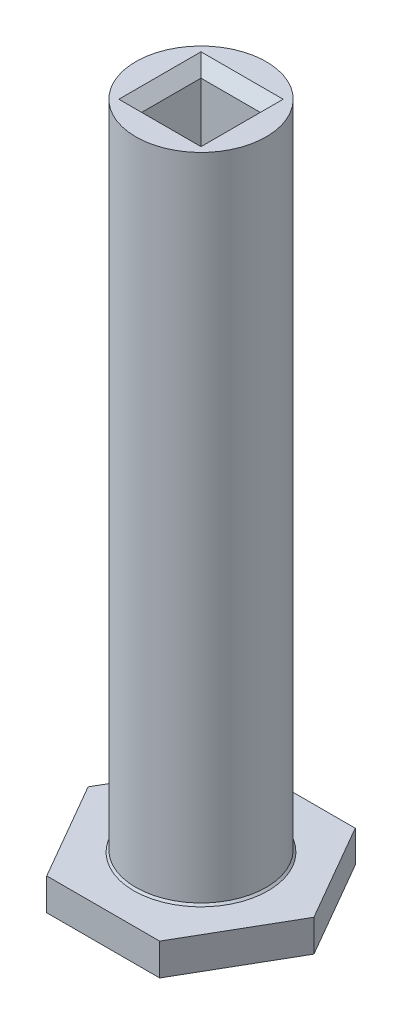
from build123d import *

# Parameters (mm, degrees)
KEY_DEPTH                     = 6.223
SKETCH2_R                     = 12.7
SHAFT_AND_WEIGHT_HOLDER_DEPTH = 127
SKETCH3_W                     = 11.557
SKETCH3_H                     = 11.557
F_8MM_SCREW_HOLE_DEPTH        = 15.875
CHAMFER1_SIZE                 = 0.381
CHAMFER2_SIZE                 = 2.2225


with BuildPart() as part:
    # Sketch1 → Key (new body)
    with BuildSketch(Plane(origin=(0, 0, 0), x_dir=(1, 0, 0), z_dir=(0, 1, 0))):
        Polygon((10.998522628, -19.05), (21.997045256, 0), (10.998522628, 19.05), (-10.998522628, 19.05), (-21.997045256, 0), (-10.998522628, -19.05), align=None)
    extrude(amount=KEY_DEPTH)


with BuildPart() as body_2:
    # Sketch2 → Shaft and Weight Holder (new body)
    with BuildSketch(Plane(origin=(0, 6.223, 0), x_dir=(1, 0, 0), z_dir=(0, 1, 0))):
        Circle(SKETCH2_R)
    extrude(amount=SHAFT_AND_WEIGHT_HOLDER_DEPTH)

    # Sketch3 → 8mm Screw Hole (cut)
    with BuildSketch(Plane(origin=(0, 133.223, 0), x_dir=(1, 0, 0), z_dir=(0, 1, 0))):
        Rectangle(SKETCH3_W, SKETCH3_H)
    extrude(amount=-F_8MM_SCREW_HOLE_DEPTH, mode=Mode.SUBTRACT)

    # Combine1: union part
    add(part.part)

    # Chamfer1
    chamfer1_edges = [body_2.edges().sort_by_distance(p)[0] for p in [
        (-12.7, 6.223, 0),
    ]]
    chamfer(chamfer1_edges, length=CHAMFER1_SIZE)

    # Chamfer2
    chamfer2_edges = [body_2.edges().sort_by_distance(p)[0] for p in [
        (-5.7785, 133.223, 0),
        (0, 133.223, -5.7785),
        (5.7785, 133.223, 0),
        (0, 133.223, 5.7785),
    ]]
    chamfer(chamfer2_edges, length=CHAMFER2_SIZE)


solid = body_2.part
